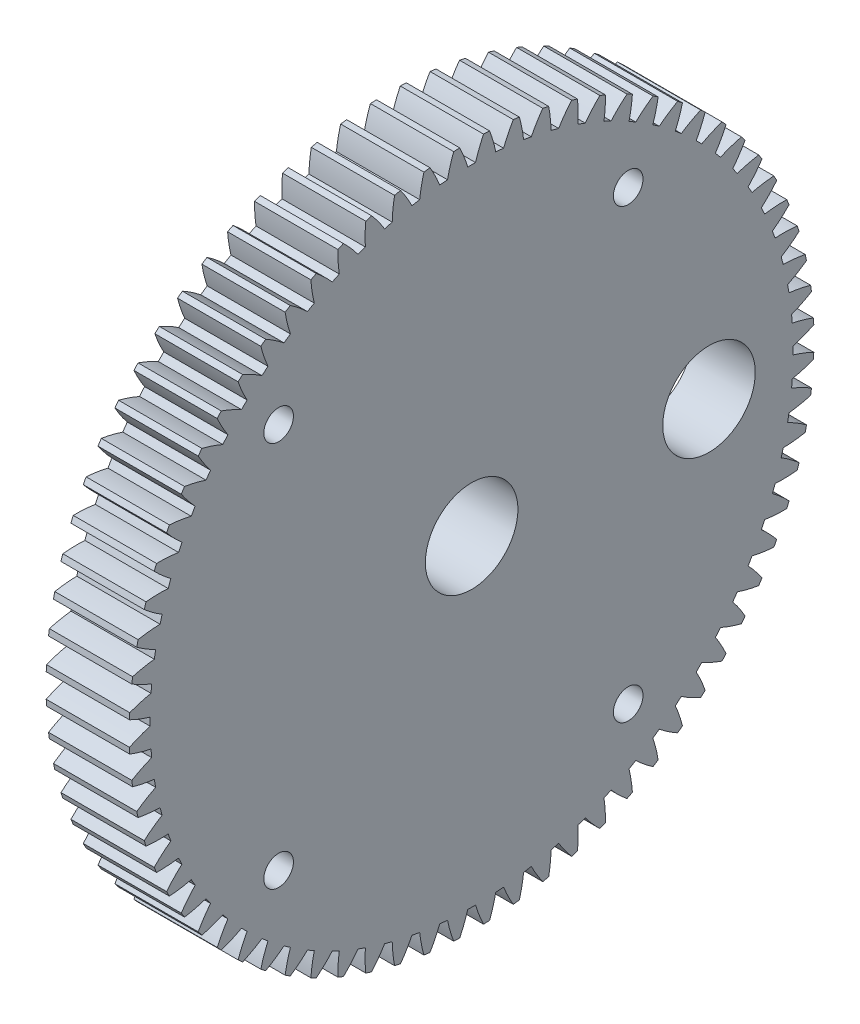
from build123d import *

# Parameters (mm, degrees)
BASPROSKE_W                                         = 9
BASPROSKE_H                                         = 37
TOOTHCUT_DEPTH                                      = 54.09425581
TEETHCUTS_COUNT                                     = 72
TEETHCUTS_ANGLE                                     = 355
HUBNEAONESKE_R                                      = 10.5
HUBNEARONE_DEPTH                                    = 9.0000508
BORSKE_R                                            = 5
BORE_DEPTH                                          = 18.0000508
CUT_EXTRUDE1_START                                  = -2.2
SKETCH1_R                                           = 33
SKETCH1_R_2                                         = 10.5
CUT_EXTRUDE1_DEPTH                                  = 2.2
SKETCH2_R                                           = 5
CUT_EXTRUDE3_DEPTH                                  = 54.480185965
CUT_EXTRUDE4_DEPTH                                  = 54.063076309
CUT_EXTRUDE4_DEPTH_BACK                             = 54.063076309
SKETCH3_W                                           = 9.0000508
SKETCH3_H                                           = 21
CUT_EXTRUDE5_REACH                                  = 54.735
SKETCH4_R                                           = 1.6
CSK_FOR_M3_COUNTERSUNK_FLAT_HEAD_SCREW1_D           = 3.2
CSK_FOR_M3_COUNTERSUNK_FLAT_HEAD_SCREW1_CSINK_D     = 6.3
CSK_FOR_M3_COUNTERSUNK_FLAT_HEAD_SCREW1_CSINK_ANGLE = 90


with BuildPart() as part:
    # BasProSke → Base-Revolve (revolve)
    with BuildSketch(Plane(origin=(0, 0, 0), x_dir=(1, 0, 0), z_dir=(0, 1, 0))):
        with Locations((4.5, 18.5)):
            Rectangle(BASPROSKE_W, BASPROSKE_H)
    revolve(axis=Axis((-10, 0, 0), (1, 0, 0)))

    # TooCutSke → ToothCut (cut, through all)
    with BuildSketch(Plane(origin=(0, 0, 0), x_dir=(0, 0, -1), z_dir=(1, 0, 0))):
        with BuildLine():
            ThreePointArc((0.423780778, 34.746415799), (0, 34.749), (-0.423780778, 34.746415799))
            ThreePointArc((-0.423780778, 34.746415799), (-0.813812371, 35.892927914), (-1.298800936, 37.002612898))
            ThreePointArc((-1.298800936, 37.002612898), (0, 37.0254), (1.298800936, 37.002612898))
            ThreePointArc((1.298800936, 37.002612898), (0.813812371, 35.892927914), (0.423780778, 34.746415799))
        make_face()
    toothcut = extrude(amount=TOOTHCUT_DEPTH, mode=Mode.SUBTRACT)

    # TeethCuts: ToothCut ×72 about axis
    teethcuts_axis = Axis((-10, 0, 0), (1, 0, 0))
    for i in range(1, TEETHCUTS_COUNT):
        add(toothcut.rotate(teethcuts_axis, i * TEETHCUTS_ANGLE / (TEETHCUTS_COUNT - 1)), mode=Mode.SUBTRACT)

    # HubNeaOneSke → HubNearOne (add)
    with BuildSketch(Plane.ZY):
        Circle(HUBNEAONESKE_R)
    extrude(amount=HUBNEARONE_DEPTH)

    # BorSke → Bore (cut, symmetric)
    with BuildSketch(Plane(origin=(0, 0, 0), x_dir=(0, 0, -1), z_dir=(1, 0, 0))):
        Circle(BORSKE_R)
    extrude(amount=BORE_DEPTH, both=True, mode=Mode.SUBTRACT)

    # Sketch1 → Cut-Extrude1 (cut)
    with BuildSketch(Plane.ZY.offset(CUT_EXTRUDE1_START)):
        Circle(SKETCH1_R)
        Circle(SKETCH1_R_2, mode=Mode.SUBTRACT)
    extrude(amount=CUT_EXTRUDE1_DEPTH, mode=Mode.SUBTRACT)

    # Sketch2 → Cut-Extrude3 (cut, through all)
    with BuildSketch(Plane.ZY.offset(-2.2)):
        with Locations((-25.655, 0)):
            Circle(SKETCH2_R)
        Circle(SKETCH2_R)
    extrude(amount=-CUT_EXTRUDE3_DEPTH, mode=Mode.SUBTRACT)

    # Sketch3 → Cut-Extrude4 (cut, two sides: drawn at the far end of the back side and taken through both)
    with BuildSketch(Plane.XY.offset(-CUT_EXTRUDE4_DEPTH_BACK)):
        with Locations((-4.5000254, 0)):
            Rectangle(SKETCH3_W, SKETCH3_H)
    extrude(amount=CUT_EXTRUDE4_DEPTH + CUT_EXTRUDE4_DEPTH_BACK, mode=Mode.SUBTRACT)

    # Sketch4 → Cut-Extrude5 (cut, up to next)
    with BuildSketch(Plane.ZY.offset(-2.2), mode=Mode.PRIVATE) as cut_extrude5_sk1:
        with Locations((20.859650045, 20.859650045)):
            Circle(SKETCH4_R)
    cut_extrude5_tool1 = extrude(cut_extrude5_sk1.sketch, amount=-CUT_EXTRUDE5_REACH, mode=Mode.PRIVATE) & part.part
    # Sketch4 → Cut-Extrude5 (cut, up to next)
    with BuildSketch(Plane.ZY.offset(-2.2), mode=Mode.PRIVATE) as cut_extrude5_sk2:
        with Locations((20.859650045, -20.859650045)):
            Circle(SKETCH4_R)
    cut_extrude5_tool2 = extrude(cut_extrude5_sk2.sketch, amount=-CUT_EXTRUDE5_REACH, mode=Mode.PRIVATE) & part.part
    # Sketch4 → Cut-Extrude5 (cut, up to next)
    with BuildSketch(Plane.ZY.offset(-2.2), mode=Mode.PRIVATE) as cut_extrude5_sk3:
        with Locations((-16.920504872, 24.164985307)):
            Circle(SKETCH4_R)
    cut_extrude5_tool3 = extrude(cut_extrude5_sk3.sketch, amount=-CUT_EXTRUDE5_REACH, mode=Mode.PRIVATE) & part.part
    # Sketch4 → Cut-Extrude5 (cut, up to next)
    with BuildSketch(Plane.ZY.offset(-2.2), mode=Mode.PRIVATE) as cut_extrude5_sk4:
        with Locations((-16.920504872, -24.164985307)):
            Circle(SKETCH4_R)
    cut_extrude5_tool4 = extrude(cut_extrude5_sk4.sketch, amount=-CUT_EXTRUDE5_REACH, mode=Mode.PRIVATE) & part.part
    add(cut_extrude5_tool1.solids().sort_by_distance((2.2, 20.85965, 20.85965))[0], mode=Mode.SUBTRACT)
    add(cut_extrude5_tool2.solids().sort_by_distance((2.2, -20.85965, 20.85965))[0], mode=Mode.SUBTRACT)
    add(cut_extrude5_tool3.solids().sort_by_distance((2.2, 24.164985, -16.920505))[0], mode=Mode.SUBTRACT)
    add(cut_extrude5_tool4.solids().sort_by_distance((2.2, -24.164985, -16.920505))[0], mode=Mode.SUBTRACT)

    # CSK for M3 Countersunk Flat Head Screw1 (through all)
    with Locations(Plane.ZY.offset(-2.2)):
        with Locations((20.859650045, 20.859650045), (20.859650045, -20.859650045), (-16.920504872, 24.164985307), (-16.920504872, -24.164985307)):
            CounterSinkHole(CSK_FOR_M3_COUNTERSUNK_FLAT_HEAD_SCREW1_D / 2, CSK_FOR_M3_COUNTERSUNK_FLAT_HEAD_SCREW1_CSINK_D / 2, counter_sink_angle=CSK_FOR_M3_COUNTERSUNK_FLAT_HEAD_SCREW1_CSINK_ANGLE)


solid = part.part
